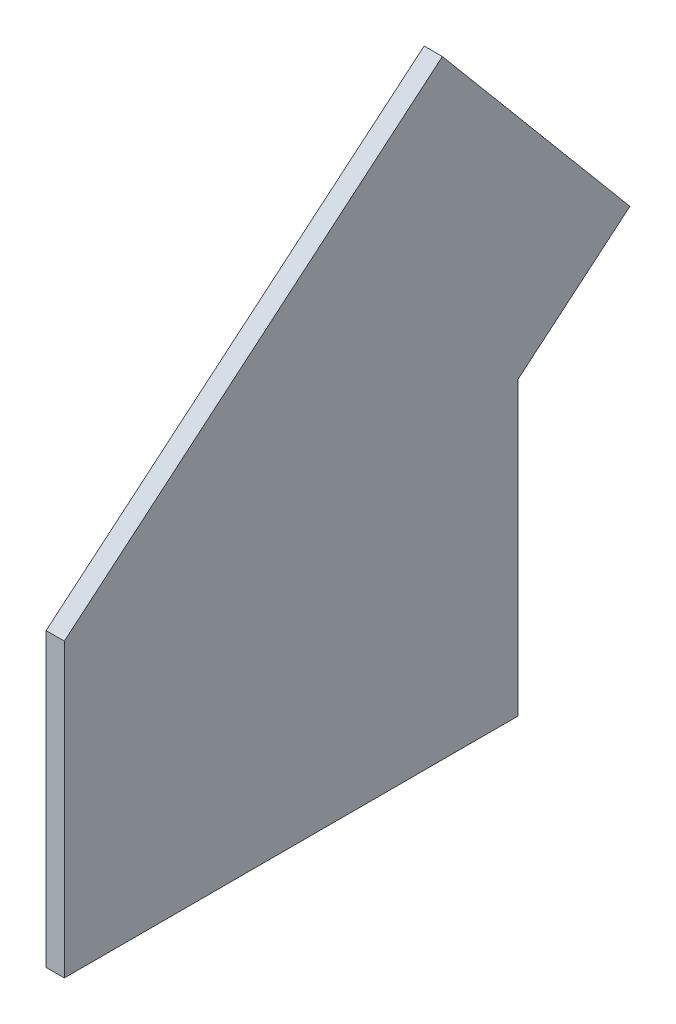
from build123d import *

# Parameters (mm, degrees)
BOSS_EXTRUDE1_DEPTH = 3.175


with BuildPart() as part:
    # Sketch1 → Boss-Extrude1 (new body)
    with BuildSketch(Plane(origin=(0, 0, 0), x_dir=(0, 0, -1), z_dir=(1, 0, 0))):
        Polygon((0, 0), (0, 50.8), (19.457528855, 67.126805286), (-13.196081717, 106.041862996), (-79.030770405, 50.8), (-79.030770405, 0), align=None)
    extrude(amount=BOSS_EXTRUDE1_DEPTH)


solid = part.part
